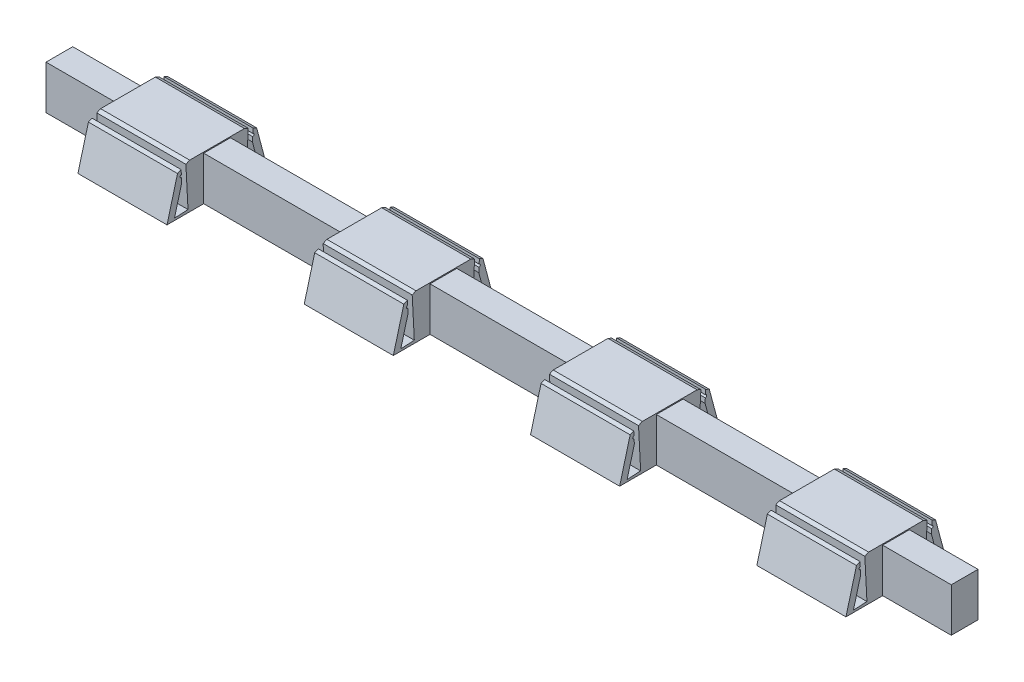
from build123d import *

# Parameters (mm, degrees)
CLIP_1_DEPTH           = 10
CENTER_BEAM_DEPTH      = 177.8
CENTER_BEAM_DEPTH_BACK = 25.4
SKETCH4_W              = 6.003992509
SKETCH4_H              = 9.824299843
LPATTERN1_COUNT        = 4
LPATTERN1_PITCH        = 50.8


with BuildPart() as part:
    # Sketch1 → Clip #1 (new, symmetric)
    with BuildSketch(Plane(origin=(0, 0, 0), x_dir=(0, 0, -1), z_dir=(1, 0, 0))):
        with BuildLine():
            Line((12.065117624, 6.527957461), (13.688135282, 0.470773101))
            Line((13.688135282, 0.470773101), (10.65449658, 0.629759368))
            Line((10.65449658, 0.629759368), (11.127959845, 9.663976652))
            Line((11.127959845, 9.663976652), (10.276501875, 10.051021125))
            Line((10.276501875, 10.051021125), (-2.020582185, 10.051021125))
            Line((-2.020582185, 10.051021125), (-2.872040155, 9.663976652))
            Line((-2.872040155, 9.663976652), (-2.398576889, 0.629759368))
            Line((-2.398576889, 0.629759368), (-5.432215592, 0.470773101))
            Line((-5.432215592, 0.470773101), (-3.809197934, 6.527957461))
            Line((-3.809197934, 6.527957461), (-3.862857804, 7.55184877))
            ThreePointArc((-3.862857804, 7.55184877), (-4.178147451, 7.835736844), (-3.894259377, 8.151026491))
            Line((-3.894259377, 8.151026491), (-3.947919247, 9.174917801))
            Line((-3.947919247, 9.174917801), (-4.750632418, 8.810031092))
            Line((-4.750632418, 8.810031092), (-7.111273134, 0))
            Line((-7.111273134, 0), (-2.365572599, 0))
            Line((-2.365572599, 0), (10.62149229, 0))
            Line((10.62149229, 0), (15.367192825, 0))
            Line((15.367192825, 0), (13.006552108, 8.810031092))
            Line((13.006552108, 8.810031092), (12.203838937, 9.174917801))
            Line((12.203838937, 9.174917801), (12.150179068, 8.151026491))
            ThreePointArc((12.150179068, 8.151026491), (12.434067141, 7.835736844), (12.118777494, 7.55184877))
            Line((12.118777494, 7.55184877), (12.065117624, 6.527957461))
        make_face()
    clip_1 = extrude(amount=CLIP_1_DEPTH, both=True)

    # Sketch4 → Center beam (add, two sides: drawn at the far end of the back side and taken through both)
    with BuildSketch(Plane(origin=(0, 0, 0), x_dir=(0, 0, -1), z_dir=(1, 0, 0)).offset(-CENTER_BEAM_DEPTH_BACK)):
        with Locations((4.127959846, 4.912149922)):
            Rectangle(SKETCH4_W, SKETCH4_H)
    extrude(amount=CENTER_BEAM_DEPTH + CENTER_BEAM_DEPTH_BACK)

    # LPattern1: Clip #1 ×4
    with Locations(*[(i * LPATTERN1_PITCH, 0, 0) for i in range(1, LPATTERN1_COUNT)]):
        add(clip_1)


solid = part.part
